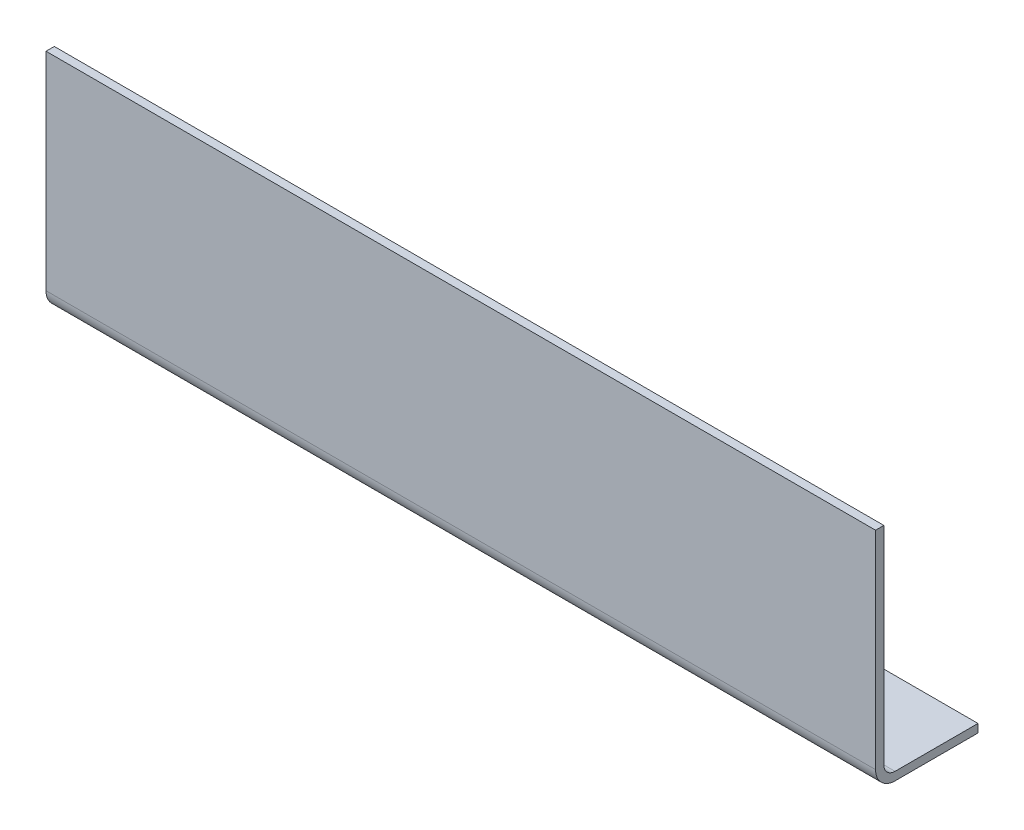
from build123d import *

# Parameters (mm, degrees)
BOSS_EXTRUDE1_DEPTH = 100


with BuildPart() as part:
    # Sketch1 → Boss-Extrude1 (new, symmetric)
    with BuildSketch(Plane(origin=(0, 0, 0), x_dir=(0, 0, -1), z_dir=(1, 0, 0))):
        with BuildLine():
            Line((-4, 3.746468452), (-4, -46.253531548))
            ThreePointArc((-4, -46.253531548), (-2.623401872, -49.57693342), (0.7, -50.953531548))
            Line((0.7, -50.953531548), (20.7, -50.953531548))
            Line((20.7, -50.953531548), (20.7, -48.953531548))
            Line((20.7, -48.953531548), (0.7, -48.953531548))
            ThreePointArc((0.7, -48.953531548), (-1.209188309, -48.162719858), (-2, -46.253531548))
            Line((-2, -46.253531548), (-2, 3.746468452))
            Line((-2, 3.746468452), (-4, 3.746468452))
        make_face()
    extrude(amount=BOSS_EXTRUDE1_DEPTH, both=True)


solid = part.part
